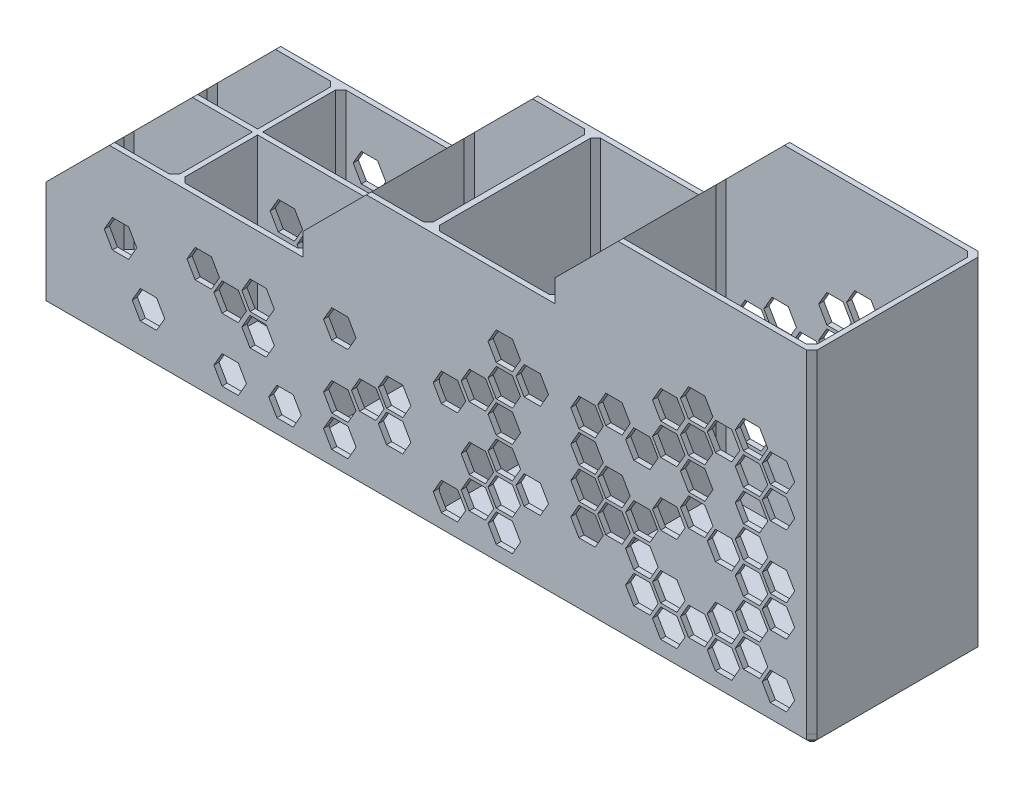
from build123d import *

# Parameters (mm, degrees)
BOSS_EXTRUDE1_DEPTH = 100
BOSS_EXTRUDE3_REACH = 160.607
SKETCH7_W           = 225
SKETCH7_H           = 3
SKETCH3_W           = 1.756110474
SKETCH3_H           = 47
BOSS_EXTRUDE2_DEPTH = 100
SKETCH5_W           = 75.000000224
SKETCH5_H           = 50
CUT_EXTRUDE1_DEPTH  = 50
SKETCH6_W           = 73.499999776
SKETCH6_H           = 50
CUT_EXTRUDE2_DEPTH  = 25
CHAMFER1_SIZE       = 1.5
CHAMFER2_SIZE       = 1.5
CHAMFER3_SIZE       = 1.5
CHAMFER4_SIZE       = 20
CUT_EXTRUDE3_DEPTH  = 50


# Some blends are built 0.0001 mm under size
with BuildPart() as part:
    # Sketch2 → Boss-Extrude1 (new body)
    with BuildSketch(Plane(origin=(0, 0, 0), x_dir=(1, 0, 0), z_dir=(0, 1, 0))):
        Polygon((-111, 25), (111, 25), (112.5, 23.5), (112.5, -23.5), (111, -25), (-111, -25), (-112.5, -23.5), (-112.5, 23.5), align=None)
        Polygon((-109.5, -23.5), (-38.999999776, -23.5), (-37.499999776, -22), (-37.499999776, 22), (-38.999999776, 23.5), (-109.5, 23.5), (-111, 22), (-111, -22), align=None, mode=Mode.SUBTRACT)
        Polygon((111, -22), (111, 22), (109.5, 23.5), (38.999999776, 23.5), (37.499999776, 22), (37.499999776, -22), (38.999999776, -23.5), (109.5, -23.5), align=None, mode=Mode.SUBTRACT)
        Polygon((-34.5, 23.5), (34.5, 23.5), (36, 22), (36, -22), (34.5, -23.5), (-34.5, -23.5), (-36, -22), (-36, 22), align=None, mode=Mode.SUBTRACT)
    extrude(amount=BOSS_EXTRUDE1_DEPTH)

    # Boss-Extrude3: up to this face of the body (flat: up to its plane)
    boss_extrude3_end = Plane(part.part.faces().sort_by_distance((0, 50, -25))[0])
    # Sketch7 → Boss-Extrude3 (add, up to the picked face)
    with BuildSketch(Plane.XY.offset(25), mode=Mode.PRIVATE) as boss_extrude3_sk1:
        with Locations((0, 1.5)):
            Rectangle(SKETCH7_W, SKETCH7_H)
    boss_extrude3_tool1 = split(extrude(boss_extrude3_sk1.sketch, amount=-BOSS_EXTRUDE3_REACH, mode=Mode.PRIVATE), bisect_by=boss_extrude3_end, keep=Keep.BOTH, mode=Mode.PRIVATE)
    add(boss_extrude3_tool1.solids().sort_by(Axis((0, 1.5, 25), (0, 0, -1)))[0])

    # Sketch3 → Boss-Extrude2 (add)
    with BuildSketch(Plane(origin=(0, 100, 0), x_dir=(1, 0, 0), z_dir=(0, 1, 0))):
        Polygon((-110.999999776, 0.75), (-74.999999888, 0.75), (-74.999999888, 23.5), (-73.499999888, 23.5), (-73.499999888, 0.75), (-37.499999776, 0.75), (-37.499999776, -0.75), (-73.499999888, -0.75), (-73.499999888, -23.5), (-74.999999888, -23.5), (-74.999999888, -0.75), (-110.999999776, -0.75), align=None)
        Rectangle(SKETCH3_W, SKETCH3_H)
    extrude(amount=-BOSS_EXTRUDE2_DEPTH)

    # Sketch5 → Cut-Extrude1 (cut)
    with BuildSketch(Plane(origin=(0, 100, 0), x_dir=(1, 0, 0), z_dir=(0, 1, 0))):
        with Locations((-74.999999888, 0)):
            Rectangle(SKETCH5_W, SKETCH5_H)
    extrude(amount=-CUT_EXTRUDE1_DEPTH, mode=Mode.SUBTRACT)

    # Sketch6 → Cut-Extrude2 (cut)
    with BuildSketch(Plane(origin=(0, 100, 0), x_dir=(1, 0, 0), z_dir=(0, 1, 0))):
        with Locations((-0.749999888, 0)):
            Rectangle(SKETCH6_W, SKETCH6_H)
    extrude(amount=-CUT_EXTRUDE2_DEPTH, mode=Mode.SUBTRACT)

    # Chamfer1
    chamfer1_edges = [part.edges().sort_by_distance(p)[0] for p in [
        (-37.499999776, 26.5, 0.75),
        (-73.499999888, 26.5, 23.5),
        (-74.999999888, 26.5, 23.5),
        (-110.999999776, 26.5, 0.75),
        (-110.999999776, 26.5, -0.75),
        (-74.999999888, 26.5, -23.5),
        (-73.499999888, 26.5, -23.5),
        (-37.499999776, 26.5, -0.75),
        (0.878055237, 39, -23.5),
        (0.878055237, 39, 23.5),
        (-0.878055237, 39, 23.5),
        (-0.878055237, 39, -23.5),
        (-37.499999776, 62.5, 25),
        (-37.499999776, 62.5, -25),
        (36, 87.5, -25),
        (36, 87.5, 25),
    ]]
    chamfer(chamfer1_edges, length=CHAMFER1_SIZE)

    # Chamfer2
    chamfer2_edges = [part.edges().sort_by_distance(p)[0] for p in [
        (112.5, 1.5, 25),
        (112.5, 1.5, -25),
        (-112.5, 1.5, -25),
        (-112.5, 1.5, 25),
    ]]
    chamfer(chamfer2_edges, length=CHAMFER2_SIZE - 0.0001)  # a hair under: the kernel refuses the full size

    # Chamfer3
    chamfer3_edges = [part.edges().sort_by_distance(p)[0] for p in [
        (0, 0, 25),
        (112.5, 0, 0),
        (-112.5, 0, 0),
        (0, 0, -25),
        (-111.75005, 0, 24.25005),
        (-111.75005, 0, -24.25005),
        (111.75005, 0, -24.25005),
        (111.75005, 0, 24.25005),
    ]]
    chamfer(chamfer3_edges, length=CHAMFER3_SIZE)

    # Chamfer4
    # the kernel refuses this chamfer: 20 mm, written as the material it takes off along each edge
    with BuildSketch(Plane(origin=(36, 100, -74.933659759), x_dir=(0.9996219169112968, 0.027495876610586317, 0), z_dir=(0, 0, 1)), Plane(origin=(-112.5, 50, -74.933659759), x_dir=(0.9996219169112968, 0.027495876610586317, 0), z_dir=(0, 0, 1))) as chamfer4_piece_1:
        Polygon((CHAMFER4_SIZE * 0.999621916911, -CHAMFER4_SIZE * 0.0274958766106), (-CHAMFER4_SIZE * 0.0274958766106, -CHAMFER4_SIZE * 0.999621916911), (0, 0), align=None)
    extrude(amount=149.867319519, mode=Mode.SUBTRACT)
    with BuildSketch(Plane(origin=(-37.499999776, 75, 74.933659759), x_dir=(0.9996219169112968, 0.027495876610586317, 0), z_dir=(0, 0, -1))) as chamfer4_piece_2:
        Polygon((CHAMFER4_SIZE * 0.999621916911, CHAMFER4_SIZE * 0.0274958766106), (-CHAMFER4_SIZE * 0.0274958766106, CHAMFER4_SIZE * 0.999621916911), (0, 0), align=None)
    extrude(amount=149.867319519, mode=Mode.SUBTRACT)

    # Sketch8 → Cut-Extrude3 (cut)
    with BuildSketch(Plane.XY.offset(25)):
        Polygon((91.498754814, 9.700407415), (89.123343966, 13.814739692), (84.37252227, 13.814739692), (81.997111422, 9.700407415), (84.37252227, 5.586075137), (89.123343966, 5.586075137), align=None)
        Polygon((107.498754814, 9.700407415), (105.123343966, 13.814739692), (100.37252227, 13.814739692), (97.997111422, 9.700407415), (100.37252227, 5.586075137), (105.123343966, 5.586075137), align=None)
        Polygon((99.645585867, 14.23443662), (97.270175019, 18.348768898), (92.519353323, 18.348768898), (90.143942475, 14.23443662), (92.519353323, 10.120104343), (97.270175019, 10.120104343), align=None)
        Polygon((83.645585867, 14.23443662), (81.270175019, 18.348768898), (76.519353323, 18.348768898), (74.143942475, 14.23443662), (76.519353323, 10.120104343), (81.270175019, 10.120104343), align=None)
        Polygon((67.645585867, 14.23443662), (65.270175019, 18.348768898), (60.519353323, 18.348768898), (58.143942475, 14.23443662), (60.519353323, 10.120104343), (65.270175019, 10.120104343), align=None)
        Polygon((19.645585867, 14.23443662), (17.270175019, 18.348768898), (12.519353323, 18.348768898), (10.143942475, 14.23443662), (12.519353323, 10.120104343), (17.270175019, 10.120104343), align=None)
        Polygon((-76.354414133, 14.23443662), (-78.729824981, 18.348768898), (-83.480646677, 18.348768898), (-85.856057525, 14.23443662), (-83.480646677, 10.120104343), (-78.729824981, 10.120104343), align=None)
        Polygon((75.498754814, 9.700407415), (73.123343966, 13.814739692), (68.37252227, 13.814739692), (65.997111422, 9.700407415), (68.37252227, 5.586075137), (73.123343966, 5.586075137), align=None)
        Polygon((27.498754814, 9.700407415), (25.123343966, 13.814739692), (20.37252227, 13.814739692), (17.997111422, 9.700407415), (20.37252227, 5.586075137), (25.123343966, 5.586075137), align=None)
        Polygon((11.498754814, 9.700407415), (9.123343966, 13.814739692), (4.37252227, 13.814739692), (1.997111422, 9.700407415), (4.37252227, 5.586075137), (9.123343966, 5.586075137), align=None)
        Polygon((-20.501245186, 9.700407415), (-22.876656034, 13.814739692), (-27.62747773, 13.814739692), (-30.002888578, 9.700407415), (-27.62747773, 5.586075137), (-22.876656034, 5.586075137), align=None)
        Polygon((-36.501245186, 9.700407415), (-38.876656034, 13.814739692), (-43.62747773, 13.814739692), (-46.002888578, 9.700407415), (-43.62747773, 5.586075137), (-38.876656034, 5.586075137), align=None)
        Polygon((-52.501245186, 9.700407415), (-54.876656034, 13.814739692), (-59.62747773, 13.814739692), (-62.002888578, 9.700407415), (-59.62747773, 5.586075137), (-54.876656034, 5.586075137), align=None)
        Polygon((75.498754814, 18.900407415), (73.123343966, 23.014739692), (68.37252227, 23.014739692), (65.997111422, 18.900407415), (68.37252227, 14.786075137), (73.123343966, 14.786075137), align=None)
        Polygon((27.498754814, 18.900407415), (25.123343966, 23.014739692), (20.37252227, 23.014739692), (17.997111422, 18.900407415), (20.37252227, 14.786075137), (25.123343966, 14.786075137), align=None)
        Polygon((-4.501245186, 18.900407415), (-6.876656034, 23.014739692), (-11.62747773, 23.014739692), (-14.002888578, 18.900407415), (-11.62747773, 14.786075137), (-6.876656034, 14.786075137), align=None)
        Polygon((91.498754814, 18.900407415), (89.123343966, 23.014739692), (84.37252227, 23.014739692), (81.997111422, 18.900407415), (84.37252227, 14.786075137), (89.123343966, 14.786075137), align=None)
        Polygon((-27.62747773, 23.014739692), (-30.002888578, 18.900407415), (-27.62747773, 14.786075137), (-22.876656034, 14.786075137), (-20.501245186, 18.900407415), (-22.876656034, 23.014739692), align=None)
        Polygon((107.498754814, 28.100407415), (105.123343966, 32.214739692), (100.37252227, 32.214739692), (97.997111422, 28.100407415), (100.37252227, 23.986075137), (105.123343966, 23.986075137), align=None)
        Polygon((59.498754814, 28.100407415), (57.123343966, 32.214739692), (52.37252227, 32.214739692), (49.997111422, 28.100407415), (52.37252227, 23.986075137), (57.123343966, 23.986075137), align=None)
        Polygon((27.498754814, 28.100407415), (25.123343966, 32.214739692), (20.37252227, 32.214739692), (17.997111422, 28.100407415), (20.37252227, 23.986075137), (25.123343966, 23.986075137), align=None)
        Polygon((-4.501245186, 28.100407415), (-6.876656034, 32.214739692), (-11.62747773, 32.214739692), (-14.002888578, 28.100407415), (-11.62747773, 23.986075137), (-6.876656034, 23.986075137), align=None)
        Polygon((-84.501245186, 28.100407415), (-86.876656034, 32.214739692), (-91.62747773, 32.214739692), (-94.002888578, 28.100407415), (-91.62747773, 23.986075137), (-86.876656034, 23.986075137), align=None)
        Polygon((-59.62747773, 32.214739692), (-62.002888578, 28.100407415), (-59.62747773, 23.986075137), (-54.876656034, 23.986075137), (-52.501245186, 28.100407415), (-54.876656034, 32.214739692), align=None)
        Polygon((75.498754814, 37.300407415), (73.123343966, 41.414739692), (68.37252227, 41.414739692), (65.997111422, 37.300407415), (68.37252227, 33.186075137), (73.123343966, 33.186075137), align=None)
        Polygon((107.498754814, 37.300407415), (105.123343966, 41.414739692), (100.37252227, 41.414739692), (97.997111422, 37.300407415), (100.37252227, 33.186075137), (105.123343966, 33.186075137), align=None)
        Polygon((59.498754814, 37.300407415), (57.123343966, 41.414739692), (52.37252227, 41.414739692), (49.997111422, 37.300407415), (52.37252227, 33.186075137), (57.123343966, 33.186075137), align=None)
        Polygon((27.498754814, 37.300407415), (25.123343966, 41.414739692), (20.37252227, 41.414739692), (17.997111422, 37.300407415), (20.37252227, 33.186075137), (25.123343966, 33.186075137), align=None)
        Polygon((11.498754814, 37.300407415), (9.123343966, 41.414739692), (4.37252227, 41.414739692), (1.997111422, 37.300407415), (4.37252227, 33.186075137), (9.123343966, 33.186075137), align=None)
        Polygon((91.498754814, 37.300407415), (89.123343966, 41.414739692), (84.37252227, 41.414739692), (81.997111422, 37.300407415), (84.37252227, 33.186075137), (89.123343966, 33.186075137), align=None)
        Polygon((-27.62747773, 41.414739692), (-30.002888578, 37.300407415), (-27.62747773, 33.186075137), (-22.876656034, 33.186075137), (-20.501245186, 37.300407415), (-22.876656034, 41.414739692), align=None)
        Polygon((27.498754814, 46.500407415), (25.123343966, 50.614739692), (20.37252227, 50.614739692), (17.997111422, 46.500407415), (20.37252227, 42.386075137), (25.123343966, 42.386075137), align=None)
        Polygon((75.498754814, 55.700407415), (73.123343966, 59.814739692), (68.37252227, 59.814739692), (65.997111422, 55.700407415), (68.37252227, 51.586075137), (73.123343966, 51.586075137), align=None)
        Polygon((107.498754814, 55.700407415), (105.123343966, 59.814739692), (100.37252227, 59.814739692), (97.997111422, 55.700407415), (100.37252227, 51.586075137), (105.123343966, 51.586075137), align=None)
        Polygon((59.498754814, 55.700407415), (57.123343966, 59.814739692), (52.37252227, 59.814739692), (49.997111422, 55.700407415), (52.37252227, 51.586075137), (57.123343966, 51.586075137), align=None)
        Polygon((27.498754814, 55.700407415), (25.123343966, 59.814739692), (20.37252227, 59.814739692), (17.997111422, 55.700407415), (20.37252227, 51.586075137), (25.123343966, 51.586075137), align=None)
        Polygon((75.498754814, 64.900407415), (73.123343966, 69.014739692), (68.37252227, 69.014739692), (65.997111422, 64.900407415), (68.37252227, 60.786075137), (73.123343966, 60.786075137), align=None)
        Polygon((107.498754814, 64.900407415), (105.123343966, 69.014739692), (100.37252227, 69.014739692), (97.997111422, 64.900407415), (100.37252227, 60.786075137), (105.123343966, 60.786075137), align=None)
        Polygon((91.498754814, 64.900407415), (89.123343966, 69.014739692), (84.37252227, 69.014739692), (81.997111422, 64.900407415), (84.37252227, 60.786075137), (89.123343966, 60.786075137), align=None)
        Polygon((-44.354414133, 23.43443662), (-46.729824981, 27.548768898), (-51.480646677, 27.548768898), (-53.856057525, 23.43443662), (-51.480646677, 19.320104343), (-46.729824981, 19.320104343), align=None)
        Polygon((-12.354414133, 23.43443662), (-14.729824981, 27.548768898), (-19.480646677, 27.548768898), (-21.856057525, 23.43443662), (-19.480646677, 19.320104343), (-14.729824981, 19.320104343), align=None)
        Polygon((19.645585867, 23.43443662), (17.270175019, 27.548768898), (12.519353323, 27.548768898), (10.143942475, 23.43443662), (12.519353323, 19.320104343), (17.270175019, 19.320104343), align=None)
        Polygon((35.645585867, 23.43443662), (33.270175019, 27.548768898), (28.519353323, 27.548768898), (26.143942475, 23.43443662), (28.519353323, 19.320104343), (33.270175019, 19.320104343), align=None)
        Polygon((51.645585867, 23.43443662), (49.270175019, 27.548768898), (44.519353323, 27.548768898), (42.143942475, 23.43443662), (44.519353323, 19.320104343), (49.270175019, 19.320104343), align=None)
        Polygon((67.645585867, 23.43443662), (65.270175019, 27.548768898), (60.519353323, 27.548768898), (58.143942475, 23.43443662), (60.519353323, 19.320104343), (65.270175019, 19.320104343), align=None)
        Polygon((99.645585867, 23.43443662), (97.270175019, 27.548768898), (92.519353323, 27.548768898), (90.143942475, 23.43443662), (92.519353323, 19.320104343), (97.270175019, 19.320104343), align=None)
        Polygon((-60.354414133, 32.63443662), (-62.729824981, 36.748768898), (-67.480646677, 36.748768898), (-69.856057525, 32.63443662), (-67.480646677, 28.520104343), (-62.729824981, 28.520104343), align=None)
        Polygon((-44.354414133, 32.63443662), (-46.729824981, 36.748768898), (-51.480646677, 36.748768898), (-53.856057525, 32.63443662), (-51.480646677, 28.520104343), (-46.729824981, 28.520104343), align=None)
        Polygon((51.645585867, 32.63443662), (49.270175019, 36.748768898), (44.519353323, 36.748768898), (42.143942475, 32.63443662), (44.519353323, 28.520104343), (49.270175019, 28.520104343), align=None)
        Polygon((67.645585867, 32.63443662), (65.270175019, 36.748768898), (60.519353323, 36.748768898), (58.143942475, 32.63443662), (60.519353323, 28.520104343), (65.270175019, 28.520104343), align=None)
        Polygon((99.645585867, 32.63443662), (97.270175019, 36.748768898), (92.519353323, 36.748768898), (90.143942475, 32.63443662), (92.519353323, 28.520104343), (97.270175019, 28.520104343), align=None)
        Polygon((19.645585867, 41.83443662), (17.270175019, 45.948768898), (12.519353323, 45.948768898), (10.143942475, 41.83443662), (12.519353323, 37.720104343), (17.270175019, 37.720104343), align=None)
        Polygon((51.645585867, 41.83443662), (49.270175019, 45.948768898), (44.519353323, 45.948768898), (42.143942475, 41.83443662), (44.519353323, 37.720104343), (49.270175019, 37.720104343), align=None)
        Polygon((83.645585867, 41.83443662), (81.270175019, 45.948768898), (76.519353323, 45.948768898), (74.143942475, 41.83443662), (76.519353323, 37.720104343), (81.270175019, 37.720104343), align=None)
        Polygon((99.645585867, 41.83443662), (97.270175019, 45.948768898), (92.519353323, 45.948768898), (90.143942475, 41.83443662), (92.519353323, 37.720104343), (97.270175019, 37.720104343), align=None)
        Polygon((35.645585867, 51.03443662), (33.270175019, 55.148768898), (28.519353323, 55.148768898), (26.143942475, 51.03443662), (28.519353323, 46.920104343), (33.270175019, 46.920104343), align=None)
        Polygon((51.645585867, 51.03443662), (49.270175019, 55.148768898), (44.519353323, 55.148768898), (42.143942475, 51.03443662), (44.519353323, 46.920104343), (49.270175019, 46.920104343), align=None)
        Polygon((67.645585867, 51.03443662), (65.270175019, 55.148768898), (60.519353323, 55.148768898), (58.143942475, 51.03443662), (60.519353323, 46.920104343), (65.270175019, 46.920104343), align=None)
        Polygon((83.645585867, 51.03443662), (81.270175019, 55.148768898), (76.519353323, 55.148768898), (74.143942475, 51.03443662), (76.519353323, 46.920104343), (81.270175019, 46.920104343), align=None)
        Polygon((99.645585867, 51.03443662), (97.270175019, 55.148768898), (92.519353323, 55.148768898), (90.143942475, 51.03443662), (92.519353323, 46.920104343), (97.270175019, 46.920104343), align=None)
        Polygon((83.645585867, 60.23443662), (81.270175019, 64.348768898), (76.519353323, 64.348768898), (74.143942475, 60.23443662), (76.519353323, 56.120104343), (81.270175019, 56.120104343), align=None)
        Polygon((99.645585867, 60.23443662), (97.270175019, 64.348768898), (92.519353323, 64.348768898), (90.143942475, 60.23443662), (92.519353323, 56.120104343), (97.270175019, 56.120104343), align=None)
        Polygon((83.645585867, 69.43443662), (81.270175019, 73.548768898), (76.519353323, 73.548768898), (74.143942475, 69.43443662), (76.519353323, 65.320104343), (81.270175019, 65.320104343), align=None)
        Polygon((99.645585867, 69.43443662), (97.270175019, 73.548768898), (92.519353323, 73.548768898), (90.143942475, 69.43443662), (92.519353323, 65.320104343), (97.270175019, 65.320104343), align=None)
    extrude(amount=-CUT_EXTRUDE3_DEPTH, mode=Mode.SUBTRACT)


solid = part.part
